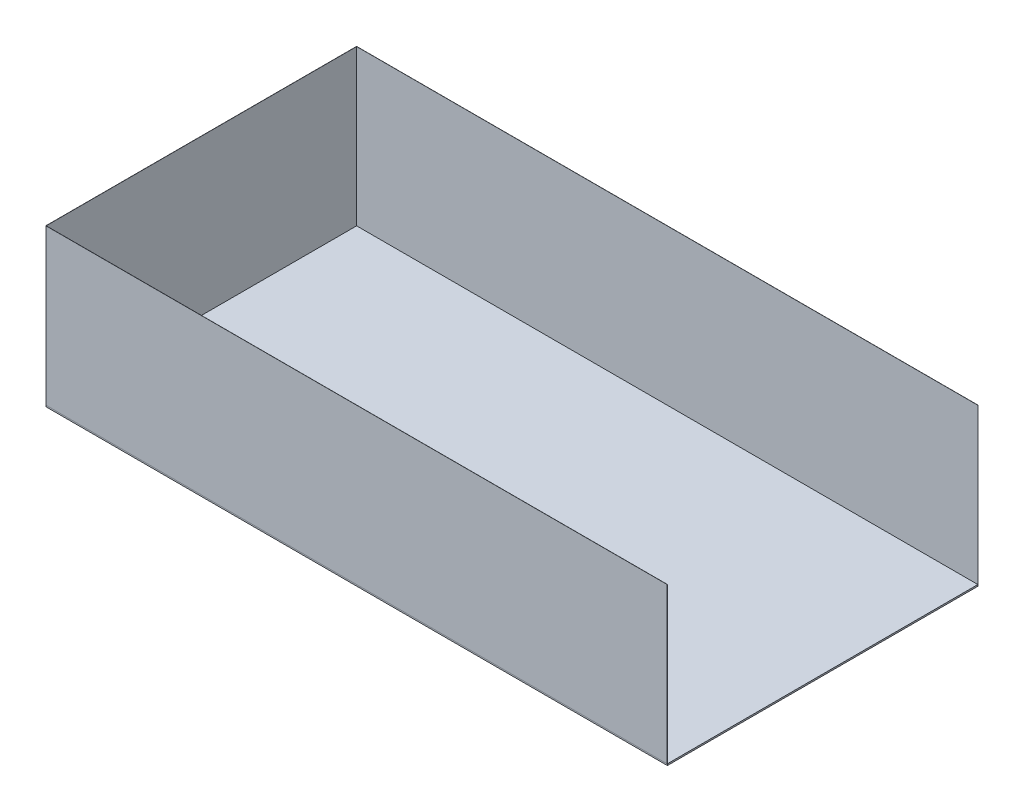
from build123d import *

# Parameters (mm, degrees)
SKETCH2_W     = 101.6
SKETCH2_H     = 50.8
FLOOR_2_DEPTH = 0.254
SKETCH4_W     = 101.6
SKETCH4_H     = 0.0254
WALL1_DEPTH   = 25.4
SKETCH5_W     = 0.0254
SKETCH5_H     = 50.7746
WALL2_DEPTH   = 25.4
SKETCH6_W     = 101.6
SKETCH6_H     = 0.0254
WALL3_DEPTH   = 25.4


with BuildPart() as part:
    # Sketch2 → Floor 2 (new body)
    with BuildSketch(Plane(origin=(0, 0, 0), x_dir=(1, 0, 0), z_dir=(0, 1, 0))):
        with Locations((11.20742268, 8.222268041)):
            Rectangle(SKETCH2_W, SKETCH2_H)
    extrude(amount=FLOOR_2_DEPTH)

    # Sketch4 → Wall1 (add)
    with BuildSketch(Plane(origin=(0, 0.254, 0), x_dir=(1, 0, 0), z_dir=(0, 1, 0))):
        with Locations((11.20742268, 33.609568041)):
            Rectangle(SKETCH4_W, SKETCH4_H)
    extrude(amount=WALL1_DEPTH)


with BuildPart() as body_2:
    # Sketch5 → Wall2 (new body)
    with BuildSketch(Plane(origin=(0, 0.254, 0), x_dir=(1, 0, 0), z_dir=(0, 1, 0))):
        with Locations((-39.60527732, 8.209568041)):
            Rectangle(SKETCH5_W, SKETCH5_H)
    extrude(amount=WALL2_DEPTH)


with BuildPart() as body_3:
    # Sketch6 → Wall3 (new body)
    with BuildSketch(Plane(origin=(0, 0.254, 0), x_dir=(1, 0, 0), z_dir=(0, 1, 0))):
        with Locations((11.20742268, -17.190431959)):
            Rectangle(SKETCH6_W, SKETCH6_H)
    extrude(amount=WALL3_DEPTH)


solid = Compound([part.part, body_2.part, body_3.part])
